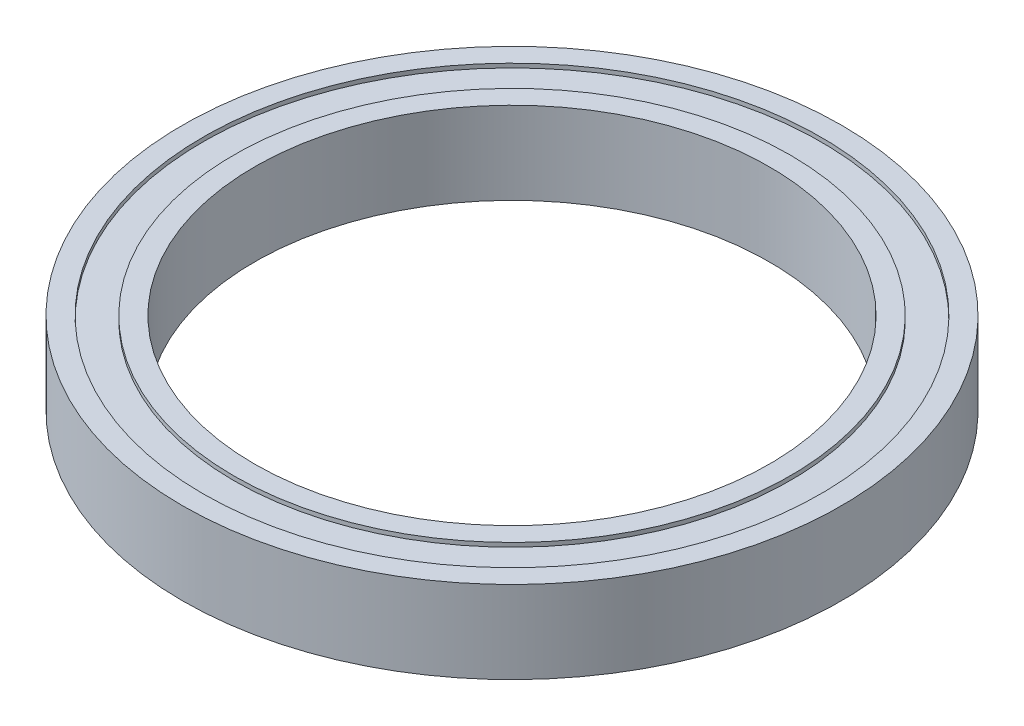
from build123d import *

# Parameters (mm, degrees)
SKETCH1_R           = 16
SKETCH1_R_2         = 12.5
BOSS_EXTRUDE1_DEPTH = 4
SKETCH2_R           = 15
SKETCH2_R_2         = 13.5
CUT_EXTRUDE1_DEPTH  = 0.2
CUT_EXTRUDE2_START  = -0.2
SKETCH3_R           = 15
SKETCH3_R_2         = 13.5
CUT_EXTRUDE2_DEPTH  = 0.2
SKETCH4_W           = 2
SKETCH4_H           = 2


with BuildPart() as part:
    # Sketch1 → Boss-Extrude1 (new body)
    with BuildSketch(Plane(origin=(0, 0, 0), x_dir=(1, 0, 0), z_dir=(0, 1, 0))):
        Circle(SKETCH1_R)
        Circle(SKETCH1_R_2, mode=Mode.SUBTRACT)
    extrude(amount=BOSS_EXTRUDE1_DEPTH)

    # Sketch2 → Cut-Extrude1 (cut)
    with BuildSketch(Plane(origin=(0, 4, 0), x_dir=(1, 0, 0), z_dir=(0, 1, 0))):
        Circle(SKETCH2_R)
        Circle(SKETCH2_R_2, mode=Mode.SUBTRACT)
    extrude(amount=-CUT_EXTRUDE1_DEPTH, mode=Mode.SUBTRACT)

    # Sketch3 → Cut-Extrude2 (cut)
    with BuildSketch(Plane.XZ.offset(CUT_EXTRUDE2_START)):
        Circle(SKETCH3_R)
        Circle(SKETCH3_R_2, mode=Mode.SUBTRACT)
    extrude(amount=CUT_EXTRUDE2_DEPTH, mode=Mode.SUBTRACT)

    # Sketch4 → Revolve1 (revolve)
    with BuildSketch(Plane(origin=(0, 0, 0), x_dir=(0, 0, -1), z_dir=(1, 0, 0))):
        with Locations((14.714397087, 2.47675995)):
            Rectangle(SKETCH4_W, SKETCH4_H)
    revolve(axis=Axis((0, 10.729847142, 0), (0, -1, 0)))


solid = part.part
